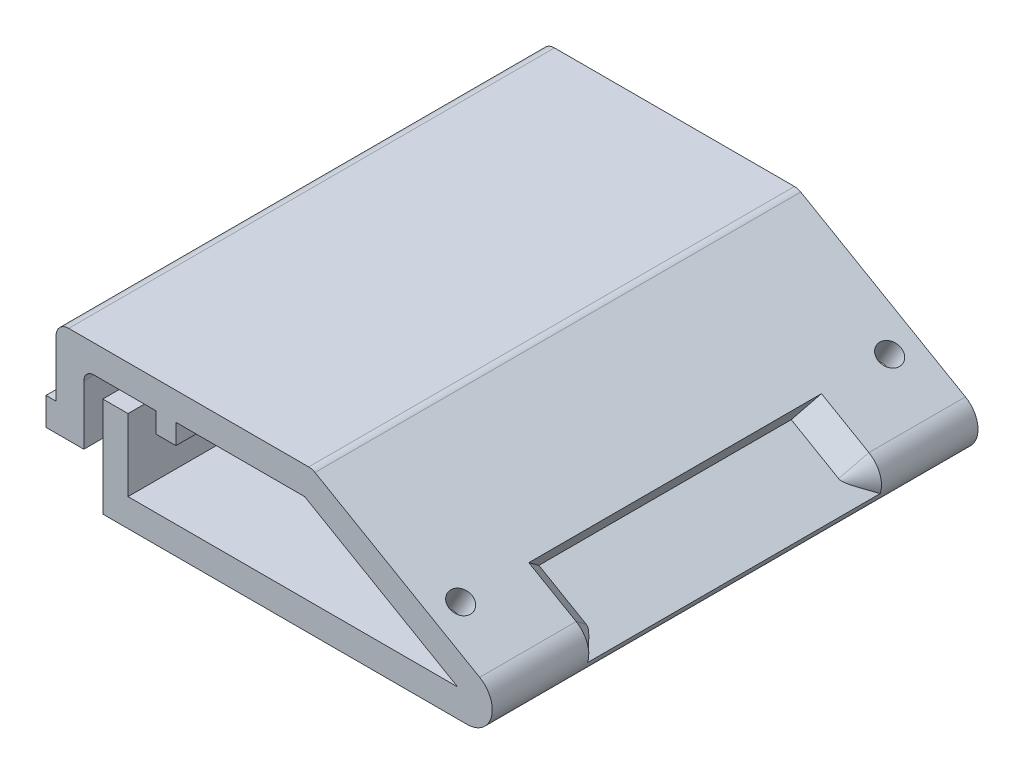
from build123d import *

# Parameters (mm, degrees)
EXTRUDE_THIN1_DEPTH = 19.25
FILLET1_R           = 2
FILLET2_R           = 1
CUT_EXTRUDE1_REACH  = 49.215
SKETCH2_R           = 0.9
SKETCH3_W           = 2
SKETCH3_H           = 5.7
SKETCH3_W_2         = 1.6
SKETCH3_H_2         = 1.6
BOSS_EXTRUDE1_DEPTH = 19.25
SKETCH9_W           = 6.335898385
SKETCH9_H           = 20
CUT_EXTRUDE4_DEPTH  = 1.6
CHAMFER2_SIZE       = 1.6
VERSION_2_DEPTH     = 0.5
FILLET3_R           = 0.8


with BuildPart() as part:
    # Sketch1 → Extrude-Thin1 (new, symmetric)
    with BuildSketch(Plane.XY):
        Polygon((13.5, -7), (41.624355653, -7), (29.5, 0), (17.5, 0), (12, 0), (12, -5.5), (9, -5.5), (9, -3.3), (9.8, -3.3), (9.8, 2.2), (17.5, 2.2), (30.089488223, 2.2), (49.83486743, -9.2), (13.5, -9.2), align=None)
    extrude(amount=EXTRUDE_THIN1_DEPTH, both=True)

    # Fillet1
    fillet1_edges = [part.edges().sort_by_distance(p)[0] for p in [
        (49.83486743, -9.2, 0),
    ]]
    fillet(fillet1_edges, radius=FILLET1_R)

    # Fillet2
    fillet2_edges = [part.edges().sort_by_distance(p)[0] for p in [
        (9.8, 2.2, 0),
        (30.089488223, 2.2, 0),
    ]]
    fillet(fillet2_edges, radius=FILLET2_R)

    # Sketch2 → Cut-Extrude1 (cut, up to next)
    with BuildSketch(Plane(origin=(8.475, 14.679130594, 0), x_dir=(0.8660254037844379, -0.5000000000000014, 0), z_dir=(0.5000000000000013, 0.8660254037844378, 0)), mode=Mode.PRIVATE) as cut_extrude1_sk1:
        with Locations(Location((35.958261188, 17, 0), (0, 0, 180))):
            Circle(SKETCH2_R)
    cut_extrude1_tool1 = extrude(cut_extrude1_sk1.sketch, amount=-CUT_EXTRUDE1_REACH, mode=Mode.PRIVATE) & part.part
    # Sketch2 → Cut-Extrude1 (cut, up to next)
    with BuildSketch(Plane(origin=(8.475, 14.679130594, 0), x_dir=(0.8660254037844379, -0.5000000000000014, 0), z_dir=(0.5000000000000013, 0.8660254037844378, 0)), mode=Mode.PRIVATE) as cut_extrude1_sk2:
        with Locations(Location((35.958261188, -17, 0), (0, 0, 180))):
            Circle(SKETCH2_R)
    cut_extrude1_tool2 = extrude(cut_extrude1_sk2.sketch, amount=-CUT_EXTRUDE1_REACH, mode=Mode.PRIVATE) & part.part
    add(cut_extrude1_tool1.solids().sort_by_distance((39.615768, -3.3, -17))[0], mode=Mode.SUBTRACT)
    add(cut_extrude1_tool2.solids().sort_by_distance((39.615768, -3.3, 17))[0], mode=Mode.SUBTRACT)

    # Sketch3 → Boss-Extrude1 (add, symmetric)
    with BuildSketch(Plane.XY):
        with Locations((14.5, -4.15)):
            Rectangle(SKETCH3_W, SKETCH3_H)
        with Locations((18.5, -0.8)):
            Rectangle(SKETCH3_W_2, SKETCH3_H_2)
    extrude(amount=BOSS_EXTRUDE1_DEPTH, both=True)

    # Sketch9 → Cut-Extrude4 (cut)
    with BuildSketch(Plane(origin=(8.475, 14.679130594, 0), x_dir=(0.8660254037844379, -0.5000000000000014, 0), z_dir=(0.5000000000000013, 0.8660254037844378, 0))):
        with Locations((39.12621038, 0)):
            Rectangle(SKETCH9_W, SKETCH9_H)
    extrude(amount=-CUT_EXTRUDE4_DEPTH, mode=Mode.SUBTRACT)

    # Chamfer2
    chamfer2_edges = [part.edges().sort_by_distance(p)[0] for p in [
        (44.240807599, -6.490814746, -10),
        (41.49326674, -4.383974596, -10),
        (44.240807599, -6.490814746, 10),
        (41.49326674, -4.383974596, 10),
    ]]
    chamfer(chamfer2_edges, length=CHAMFER2_SIZE - 0.0001)  # a hair under: the kernel refuses the full size

    # Sketch10 → VERSION 2 (cut)
    with BuildSketch(Plane.XZ.offset(9.2)):
        with BuildLine():
            add(Edge.make_bspline(
                [(17.821180591, -9.334865663), (17.823427033, -9.354295768), (17.827777632, -9.391925322), (17.839967973, -9.427780618), (17.845863804, -9.445121951)],
                knots=[0, 0, 0, 0, 1.032704525, 2, 2, 2, 2], degree=3))
            Line((17.845863804, -9.445121951), (19.043443835, -13.02648509))
            add(Edge.make_bspline(
                [(19.043443835, -13.02648509), (19.056534344, -13.05789855), (19.081451206, -13.117691862), (19.14941157, -13.186414851), (19.233135531, -13.233520924), (19.296850919, -13.241953119), (19.330010146, -13.246341463)],
                knots=[0, 0, 0, 0, 1.054683453, 2.007515722, 2.96305683, 4, 4, 4, 4], degree=3))
            add(Edge.make_bspline(
                [(19.330010146, -13.246341463), (19.364773556, -13.242026061), (19.430816852, -13.233827687), (19.517572486, -13.187212007), (19.585743855, -13.117675055), (19.61077863, -13.058089528), (19.623912585, -13.026829268)],
                knots=[0, 0, 0, 0, 1.06836729, 2.029677035, 2.966312611, 4, 4, 4, 4], degree=3))
            Line((19.623912585, -13.026829268), (20.822047588, -9.444184689))
            add(Edge.make_bspline(
                [(20.822047588, -9.444184689), (20.826491103, -9.427105546), (20.835776028, -9.391417907), (20.837597149, -9.354576142), (20.838546731, -9.335365854)],
                knots=[0, 0, 0, 0, 0.957146177, 2, 2, 2, 2], degree=3))
            add(Edge.make_bspline(
                [(20.838546731, -9.335365854), (20.836923348, -9.315295583), (20.833781564, -9.276452945), (20.815481167, -9.221225807), (20.789064482, -9.170299891), (20.750548065, -9.126818457), (20.705272039, -9.09010539), (20.654164071, -9.061121378), (20.595880504, -9.04556053), (20.555698518, -9.042057914), (20.534888194, -9.040243902)],
                knots=[0, 0, 0, 0, 1.027789528, 1.989114056, 2.957849911, 3.946954469, 4.938684973, 5.935646619, 6.930867606, 8, 8, 8, 8], degree=3))
            add(Edge.make_bspline(
                [(20.534888194, -9.040243902), (20.501810322, -9.044763663), (20.438443312, -9.053422132), (20.353499331, -9.098700331), (20.286854111, -9.168897605), (20.261528622, -9.228585262), (20.248302829, -9.259756098)],
                knots=[0, 0, 0, 0, 1.03692919, 1.986436811, 2.948451835, 4, 4, 4, 4], degree=3))
            Line((20.248302829, -9.259756098), (19.330043492, -11.992158918))
            Line((19.330043492, -11.992158918), (18.419668111, -9.25918326))
            add(Edge.make_bspline(
                [(18.419668111, -9.25918326), (18.406216435, -9.228195042), (18.380318316, -9.168534329), (18.312307115, -9.098247255), (18.224347461, -9.053073446), (18.158612531, -9.044676471), (18.123912585, -9.040243902)],
                knots=[0, 0, 0, 0, 1.028913269, 1.980936724, 2.934183284, 4, 4, 4, 4], degree=3))
            add(Edge.make_bspline(
                [(18.123912585, -9.040243902), (18.103913321, -9.042076376), (18.064938061, -9.045647563), (18.007938244, -9.061347063), (17.957042105, -9.090424361), (17.910701185, -9.126727956), (17.871125245, -9.170256963), (17.843105786, -9.220899614), (17.825093197, -9.27649028), (17.821902634, -9.315308303), (17.820254048, -9.335365854)],
                knots=[0, 0, 0, 0, 1.030543514, 2.008358934, 3.007991962, 4.018680577, 5.024181706, 6.005556065, 6.969456486, 8, 8, 8, 8], degree=3))
            Line((17.820254048, -9.335365854), (17.821180591, -9.334865663))
        make_face()
        with BuildLine():
            add(Edge.make_bspline(
                [(23.74411671, -10.275410871), (23.806017942, -10.279717556), (23.92631973, -10.288087371), (24.098147069, -10.338300852), (24.253034652, -10.418288791), (24.387190713, -10.527921265), (24.49918909, -10.659106429), (24.580508644, -10.811441053), (24.634047415, -10.979876258), (24.641858012, -11.098776275), (24.645863804, -11.159756098)],
                knots=[0, 0, 0, 0, 1.058978584, 2.058069159, 3.037758071, 4.021657752, 5.003688209, 5.968206507, 6.9579614, 8, 8, 8, 8], degree=3))
            Line((24.645863804, -11.159756098), (24.646062689, -11.745693598))
            add(Edge.make_bspline(
                [(24.646062689, -11.745693598), (24.642002736, -11.806894819), (24.634100526, -11.926015627), (24.580294344, -12.094952377), (24.498953489, -12.248350714), (24.387241839, -12.381561155), (24.253842986, -12.494197242), (24.097840631, -12.573422178), (23.926366291, -12.62587062), (23.805609319, -12.633748247), (23.74342478, -12.637804878)],
                knots=[0, 0, 0, 0, 1.041256597, 2.026680567, 2.993073191, 3.981435433, 4.969797675, 5.945199709, 6.941868068, 8, 8, 8, 8], degree=3))
            Line((23.74342478, -12.637804878), (22.53871227, -12.637804878))
            add(Edge.make_bspline(
                [(22.53871227, -12.637804878), (22.517774836, -12.638948206), (22.476853043, -12.641182818), (22.419327891, -12.659417458), (22.366245075, -12.68464407), (22.321774695, -12.722159718), (22.283128278, -12.765370476), (22.256540853, -12.816686259), (22.238059612, -12.873148145), (22.235974423, -12.91325411), (22.234888194, -12.934146341)],
                knots=[0, 0, 0, 0, 1.060955747, 2.073616602, 3.043257174, 4.026868974, 5.007876325, 5.968681719, 6.941833903, 8, 8, 8, 8], degree=3))
            add(Edge.make_bspline(
                [(22.234888194, -12.934146341), (22.236063479, -12.955015303), (22.238363506, -12.99585578), (22.256256688, -13.053682343), (22.283105585, -13.106507249), (22.321708012, -13.15098506), (22.366185823, -13.189587487), (22.41901073, -13.216436384), (22.476837292, -13.234329567), (22.517677769, -13.236629594), (22.538546731, -13.237804878)],
                knots=[0, 0, 0, 0, 1.045974665, 2.046968367, 3.014737927, 4, 4.985262073, 5.953031633, 6.954025335, 8, 8, 8, 8], degree=3))
            Line((22.538546731, -13.237804878), (23.74411671, -13.237804878))
            add(Edge.make_bspline(
                [(23.74411671, -13.237804878), (23.796411447, -13.235553714), (23.899284862, -13.231125258), (24.05015293, -13.207358615), (24.194196277, -13.170808588), (24.331503461, -13.122009482), (24.461640205, -13.060441957), (24.585658083, -12.986973711), (24.703175151, -12.90020472), (24.811664871, -12.800369626), (24.911867587, -12.692374482), (24.999818792, -12.576442432), (25.074736008, -12.453933645), (25.136114717, -12.324654801), (25.1847687, -12.188953318), (25.221543818, -12.047004307), (25.245246766, -11.898727049), (25.249700657, -11.797647477), (25.251961365, -11.746341463)],
                knots=[0, 0, 0, 0, 1.066873082, 2.098736551, 3.10817358, 4.094186606, 5.065874226, 6.03985819, 7.029802135, 8.039239164, 9.0425632, 10.030839284, 11.001996208, 11.966191853, 12.944401058, 13.937776121, 14.953255501, 16, 16, 16, 16], degree=3))
            Line((25.251961365, -11.746341463), (25.25297961, -11.159213034))
            add(Edge.make_bspline(
                [(25.25297961, -11.159213034), (25.250853867, -11.100713329), (25.246640751, -10.984769811), (25.21461485, -10.814478749), (25.166233501, -10.649696485), (25.09737981, -10.492291226), (25.011584615, -10.343399962), (24.906084074, -10.20709025), (24.785464492, -10.081112248), (24.692780645, -10.009447594), (24.645863804, -9.973170732)],
                knots=[0, 0, 0, 0, 1.014332037, 2.010355889, 2.996594147, 3.98838943, 4.983888816, 5.969874884, 6.972344594, 8, 8, 8, 8], degree=3))
            add(Edge.make_bspline(
                [(24.645863804, -9.973170732), (24.69280031, -9.935661329), (24.785619121, -9.861484991), (24.906175384, -9.731839075), (25.011678784, -9.591864332), (25.097110402, -9.439604929), (25.166312299, -9.279547867), (25.214536792, -9.112309588), (25.246864434, -8.939861939), (25.250254469, -8.822504565), (25.251961365, -8.763414634)],
                knots=[0, 0, 0, 0, 1.026490339, 2.029925523, 3.018678281, 4.018251485, 5.008860598, 5.994552535, 6.99024878, 8, 8, 8, 8], degree=3))
            add(Edge.make_bspline(
                [(25.251961365, -8.763414634), (25.249706163, -8.710889036), (25.245262075, -8.607382391), (25.221468267, -8.455496227), (25.185230043, -8.310530245), (25.135826847, -8.172644586), (25.074757945, -8.04126249), (25.00021165, -7.916435201), (24.911798, -7.799203404), (24.81211392, -7.689851266), (24.702780579, -7.590125576), (24.585712807, -7.502103779), (24.461963852, -7.427207835), (24.331466956, -7.365861824), (24.194206374, -7.316977668), (24.050150124, -7.280452404), (23.899057801, -7.256638173), (23.795951204, -7.252240395), (23.74342478, -7.25)],
                knots=[0, 0, 0, 0, 1.062461703, 2.093680967, 3.102508552, 4.080142263, 5.051013382, 6.027990232, 7.014431632, 8.015290284, 9.016148936, 10.002590336, 10.97252138, 11.935951425, 12.913585136, 13.914443788, 14.937538297, 16, 16, 16, 16], degree=3))
            Line((23.74342478, -7.25), (22.53871227, -7.248982946))
            add(Edge.make_bspline(
                [(22.53871227, -7.248982946), (22.517796864, -7.250582372), (22.476952201, -7.253705812), (22.419003753, -7.271303444), (22.366187703, -7.298234919), (22.321707504, -7.336815083), (22.283105718, -7.38129887), (22.256256652, -7.434122195), (22.238363515, -7.491949189), (22.236063482, -7.532789606), (22.234888194, -7.553658537)],
                knots=[0, 0, 0, 0, 1.049928132, 2.050352754, 3.017572123, 4.002274059, 4.986975996, 5.954195365, 6.954619987, 8, 8, 8, 8], degree=3))
            add(Edge.make_bspline(
                [(22.234888194, -7.553658537), (22.236012952, -7.574541787), (22.238193081, -7.615020011), (22.256529309, -7.672296695), (22.283079776, -7.724807496), (22.321714983, -7.7692757), (22.366183995, -7.807880706), (22.419011231, -7.83472892), (22.476837159, -7.852622289), (22.517677724, -7.85492229), (22.538546731, -7.856097561)],
                knots=[0, 0, 0, 0, 1.048536336, 2.03238894, 3.002528642, 3.990203696, 4.97787875, 5.948018452, 6.951463664, 8, 8, 8, 8], degree=3))
            Line((22.538546731, -7.856097561), (23.74411671, -7.855899867))
            add(Edge.make_bspline(
                [(23.74411671, -7.855899867), (23.806094461, -7.859950885), (23.9267768, -7.86783898), (24.097934479, -7.921796871), (24.253940539, -8.002190942), (24.387263268, -8.116081014), (24.499350934, -8.250686457), (24.580525757, -8.406713974), (24.634170788, -8.579114747), (24.641891879, -8.700810993), (24.645863804, -8.763414634)],
                knots=[0, 0, 0, 0, 1.045582401, 2.035945591, 3.006428587, 3.990968025, 4.976416705, 5.9468997, 6.943833046, 8, 8, 8, 8], degree=3))
            add(Edge.make_bspline(
                [(24.645863804, -8.763414634), (24.641846811, -8.825194417), (24.634013762, -8.945663664), (24.580634644, -9.116596411), (24.498586963, -9.271531455), (24.387801313, -9.40717472), (24.253534227, -9.52067526), (24.098324995, -9.602955168), (23.926438497, -9.65628449), (23.805608112, -9.665017763), (23.74342478, -9.669512195)],
                knots=[0, 0, 0, 0, 1.044240831, 2.036247155, 3.002264277, 3.994675749, 4.98084866, 5.956171723, 6.948178046, 8, 8, 8, 8], degree=3))
            Line((23.74342478, -9.669512195), (23.145629191, -9.66849395))
            add(Edge.make_bspline(
                [(23.145629191, -9.66849395), (23.124422762, -9.670019789), (23.083658053, -9.672952879), (23.025998737, -9.69109037), (22.973498731, -9.71772103), (22.929020905, -9.756333749), (22.890443398, -9.800811496), (22.863495414, -9.853626403), (22.845977842, -9.911536827), (22.842675126, -9.952313221), (22.840985755, -9.973170732)],
                knots=[0, 0, 0, 0, 1.064044783, 2.045392747, 3.013062719, 3.998223403, 4.983384088, 5.95105406, 6.951944754, 8, 8, 8, 8], degree=3))
            add(Edge.make_bspline(
                [(22.840985755, -9.973170732), (22.842625362, -9.994042506), (22.845800216, -10.034457595), (22.86376875, -10.091816829), (22.890417447, -10.14431923), (22.929028391, -10.188781542), (22.973495001, -10.227418549), (23.026006223, -10.253968541), (23.083282793, -10.272304897), (23.123761033, -10.274485008), (23.144644292, -10.275609756)],
                knots=[0, 0, 0, 0, 1.0530203, 2.0390173, 3.01127151, 4.001099292, 4.990927074, 5.963181283, 6.949178283, 8, 8, 8, 8], degree=3))
            Line((23.144644292, -10.275609756), (23.74411671, -10.275410871))
        make_face()
    extrude(amount=-VERSION_2_DEPTH, mode=Mode.SUBTRACT)

    # Fillet3
    fillet3_edges = [part.edges().sort_by_distance(p)[0] for p in [
        (12, 0, 0),
    ]]
    fillet(fillet3_edges, radius=FILLET3_R)


solid = part.part
